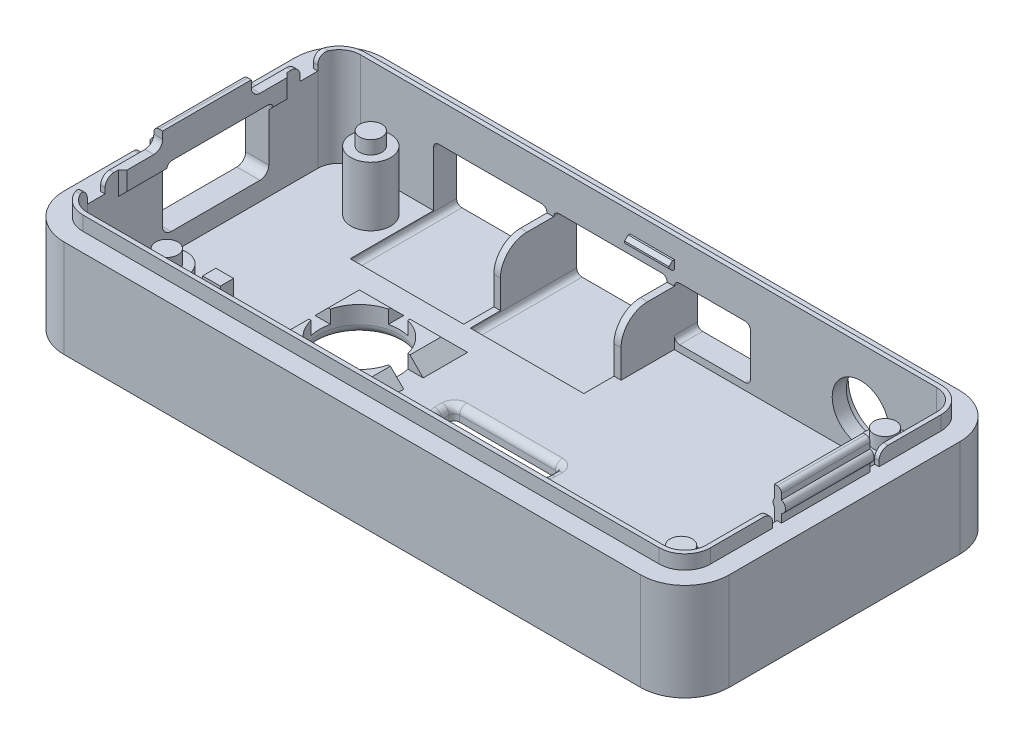
from build123d import *

# Parameters (mm, degrees)
EXTRUDE_2_DEPTH       = 11
EXTRUDE_4_DEPTH       = 1.6
CUT_EXTRUDE_START     = -9.5
CUT_EXTRUDE_2_DEPTH   = 9.5
EXTRUDE_12_DEPTH      = 1.6
EXTRUDE_12_DEPTH_BACK = 2
SKETCH_5_W            = 0.3
SKETCH_5_H            = 10
SKETCH_15_R           = 2.25
EXTRUDE_13_DEPTH      = 6.7
SKETCH_16_R           = 1.25
EXTRUDE_14_DEPTH      = 1.5
SKETCH_17_W           = 0.5
SKETCH_17_H           = 1
CUT_EXTRUDE_3_DEPTH   = 1.6
SKETCH_19_W           = 0.8
SKETCH_19_H           = 10
EXTRUDE_15_DEPTH      = 1.8
SKETCH_20_R           = 0.7
EXTRUDE_16_DEPTH      = 10
FILLET_4_R            = 0.5
SKETCH_37_W           = 5
SKETCH_37_H           = 1
EXTRUDE_17_DEPTH      = 0.6
CHAMFER_1_SIZE        = 0.4
SKETCH_38_W           = 6
SKETCH_38_H           = 1
EXTRUDE_18_DEPTH      = 0.7
CHAMFER_2_SIZE        = 0.4
SKETCH_39_R           = 4
CUT_EXTRUDE_4_DEPTH   = 1
SKETCH_41_W           = 8.6
SKETCH_41_H           = 6
SKETCH_41_W_2         = 12.8
SKETCH_41_H_2         = 7.5
CUT_EXTRUDE_5_DEPTH   = 12
FILLET_5_R            = 0.6
SKETCH_42_R           = 3.2
CUT_EXTRUDE_6_DEPTH   = 1.6
CUT_EXTRUDE_8_REACH   = 80.462
SKETCH_44_W           = 12
SKETCH_44_H           = 7.4
SKETCH_46_W           = 20
SKETCH_46_H           = 1.6
EXTRUDE_19_DEPTH      = 0.5
CHAMFER_3_SIZE        = 1
CHAMFER_4_SIZE        = 1
FILLET_7_R            = 1
SKETCH_47_W           = 0.75
SKETCH_47_H           = 6.17888613
SKETCH_47_W_2         = 0.8
EXTRUDE_20_DEPTH      = 6
FILLET_8_R            = 3
SKETCH_48_W           = 1
SKETCH_48_H           = 10
EXTRUDE_21_DEPTH      = 1.8
SKETCH_49_R           = 0.7
EXTRUDE_22_DEPTH      = 10
SKETCH_50_W           = 0.5
SKETCH_50_H           = 2
CUT_EXTRUDE_10_DEPTH  = 1.6
FILLET_9_R            = 1
FILLET_10_R           = 0.6
FILLET_11_R           = 0.6
FILLET_12_R           = 0.6
SKETCH_51_W           = 12
SKETCH_51_H           = 2
CUT_EXTRUDE_11_DEPTH  = 1.5
FILLET_13_R           = 0.6
SKETCH_52_W           = 9.2
SKETCH_52_H           = 9.2
EXTRUDE_23_DEPTH      = 1.5
CHAMFER_5_SIZE        = 1.5
CUT_EXTRUDE_12_REACH  = 47.339
SKETCH_53_R           = 4.5
FILLET_14_R           = 1
SKETCH_55_W           = 12.2
SKETCH_55_H           = 2.2
CUT_EXTRUDE_13_DEPTH  = 1.5
SKETCH_56_W           = 2.2
SKETCH_56_H           = 12.2
CUT_EXTRUDE_14_DEPTH  = 1.5
CUT_EXTRUDE_15_DEPTH  = 0.5
FILLET_15_R           = 0.8
FILLET_17_R           = 1
SKETCH_63_W           = 2
SKETCH_63_H           = 1.5
EXTRUDE_24_DEPTH      = 2


# Some blends are built 0.0001 mm under size
with BuildPart() as part:
    # case 2 → 凸台-拉伸2 (new body)
    with BuildSketch(Plane(origin=(0, 0, 0), x_dir=(1, 0, 0), z_dir=(0, 1, 0))):
        with BuildLine():
            Line((-34.042196447, 18), (30.957803553, 18))
            ThreePointArc((30.957803553, 18), (34.493337459, 16.535533906), (35.957803553, 13))
            Line((35.957803553, 13), (35.957803553, -13))
            ThreePointArc((35.957803553, -13), (34.493337459, -16.535533906), (30.957803553, -18))
            Line((30.957803553, -18), (-34.042196447, -18))
            ThreePointArc((-34.042196447, -18), (-37.577730353, -16.535533906), (-39.042196447, -13))
            Line((-39.042196447, -13), (-39.042196447, 13))
            ThreePointArc((-39.042196447, 13), (-37.577730353, 16.535533906), (-34.042196447, 18))
        make_face()
    extrude(amount=EXTRUDE_2_DEPTH)

    # 草图3 → 凸台-拉伸4 (add)
    with BuildSketch(Plane(origin=(0, 11, 0), x_dir=(1, 0, 0), z_dir=(0, 1, 0))):
        with BuildLine():
            Line((-36.942196447, 13), (-36.942196447, -13))
            ThreePointArc((-36.942196447, -13), (-36.092806113, -15.050609665), (-34.042196447, -15.9))
            Line((-34.042196447, -15.9), (30.957803553, -15.9))
            ThreePointArc((30.957803553, -15.9), (33.008413218, -15.050609665), (33.857803553, -13))
            Line((33.857803553, -13), (33.857803553, 13))
            ThreePointArc((33.857803553, 13), (33.008413218, 15.050609665), (30.957803553, 15.9))
            Line((30.957803553, 15.9), (-34.042196447, 15.9))
            ThreePointArc((-34.042196447, 15.9), (-36.092806113, 15.050609665), (-36.942196447, 13))
        make_face()
        with BuildLine():
            Line((-34.042196447, -15.4), (30.957803553, -15.4))
            ThreePointArc((30.957803553, -15.4), (32.654859828, -14.697056275), (33.357803553, -13))
            Line((33.357803553, -13), (33.357803553, 13))
            ThreePointArc((33.357803553, 13), (32.654859828, 14.697056275), (30.957803553, 15.4))
            Line((30.957803553, 15.4), (-34.042196447, 15.4))
            ThreePointArc((-34.042196447, 15.4), (-35.739252722, 14.697056275), (-36.442196447, 13))
            Line((-36.442196447, 13), (-36.442196447, -13))
            ThreePointArc((-36.442196447, -13), (-35.739252722, -14.697056275), (-34.042196447, -15.4))
        make_face(mode=Mode.SUBTRACT)
    extrude(amount=EXTRUDE_4_DEPTH)

    # 草图14 → 切除-拉伸2 (cut)
    with BuildSketch(Plane(origin=(0, 11, 0), x_dir=(1, 0, 0), z_dir=(0, 1, 0)).offset(CUT_EXTRUDE_START)):
        with BuildLine():
            Line((-34.042196447, -15.4), (30.957803553, -15.4))
            ThreePointArc((30.957803553, -15.4), (32.654859828, -14.697056275), (33.357803553, -13))
            Line((33.357803553, -13), (33.357803553, 13))
            ThreePointArc((33.357803553, 13), (32.654859828, 14.697056275), (30.957803553, 15.4))
            Line((30.957803553, 15.4), (-34.042196447, 15.4))
            ThreePointArc((-34.042196447, 15.4), (-35.739252722, 14.697056275), (-36.442196447, 13))
            Line((-36.442196447, 13), (-36.442196447, -13))
            ThreePointArc((-36.442196447, -13), (-35.739252722, -14.697056275), (-34.042196447, -15.4))
        make_face()
    extrude(amount=CUT_EXTRUDE_2_DEPTH, mode=Mode.SUBTRACT)

    # 草图5 → 凸台-拉伸12 (add, two sides: drawn at the far end of the back side and taken through both)
    with BuildSketch(Plane(origin=(0, 11, 0), x_dir=(1, 0, 0), z_dir=(0, 1, 0)).offset(-EXTRUDE_12_DEPTH_BACK)):
        with Locations((33.207803553, 0)):
            Rectangle(SKETCH_5_W, SKETCH_5_H)
    extrude(amount=EXTRUDE_12_DEPTH + EXTRUDE_12_DEPTH_BACK)

    # 草图15 → 凸台-拉伸13 (add)
    with BuildSketch(Plane(origin=(0, 1.5, 0), x_dir=(1, 0, 0), z_dir=(0, 1, 0))):
        with Locations(Location((29.060337171, -11.529492838, 0), (0, 0, 270))):
            Circle(SKETCH_15_R)
        with Locations(Location((-28.939662829, -11.529492838, 0), (0, 0, 270))):
            Circle(SKETCH_15_R)
        with Locations(Location((29.060337171, 11.470507162, 0), (0, 0, 270))):
            Circle(SKETCH_15_R)
        with Locations(Location((-28.939662829, 11.470507162, 0), (0, 0, 270))):
            Circle(SKETCH_15_R)
    extrude(amount=EXTRUDE_13_DEPTH)

    # 草图16 → 凸台-拉伸14 (add)
    with BuildSketch(Plane(origin=(0, 8.2, 0), x_dir=(1, 0, 0), z_dir=(0, 1, 0))):
        with Locations(Location((29.060337171, -11.529492838, 0), (0, 0, 270))):
            Circle(SKETCH_16_R)
        with Locations(Location((29.060337171, 11.470507162, 0), (0, 0, 270))):
            Circle(SKETCH_16_R)
        with Locations(Location((-28.939662829, -11.529492838, 0), (0, 0, 270))):
            Circle(SKETCH_16_R)
        with Locations(Location((-28.939662829, 11.470507162, 0), (0, 0, 270))):
            Circle(SKETCH_16_R)
    extrude(amount=EXTRUDE_14_DEPTH)

    # 草图17 → 切除-拉伸3 (cut)
    with BuildSketch(Plane(origin=(0, 12.6, 0), x_dir=(1, 0, 0), z_dir=(0, 1, 0))):
        with Locations((33.607803553, -5.5)):
            Rectangle(SKETCH_17_W, SKETCH_17_H)
        with Locations((33.607803553, 5.5)):
            Rectangle(SKETCH_17_W, SKETCH_17_H)
    extrude(amount=-CUT_EXTRUDE_3_DEPTH, mode=Mode.SUBTRACT)

    # 草图19 → 凸台-拉伸15 (add)
    with BuildSketch(Plane(origin=(0, 12.6, 0), x_dir=(1, 0, 0), z_dir=(0, 1, 0))):
        with Locations((33.457803553, 0)):
            Rectangle(SKETCH_19_W, SKETCH_19_H)
    extrude(amount=EXTRUDE_15_DEPTH)

    # 草图20 → 凸台-拉伸16 (add)
    with BuildSketch(Plane(origin=(0, 0, -5), x_dir=(-1, 0, 0), z_dir=(0, 0, -1))):
        with Locations((-33.607803553, 12.6)):
            Circle(SKETCH_20_R)
    extrude(amount=-EXTRUDE_16_DEPTH)

    # 圆角4
    fillet_4_edges = [part.edges().sort_by_distance(p)[0] for p in [
        (33.857803553, 14.4, 0),
    ]]
    fillet(fillet_4_edges, radius=FILLET_4_R)

    # 草图37 → 凸台-拉伸17 (add)
    with BuildSketch(Plane.XY.offset(-15.4)):
        with Locations((-1.142196447, 9.8)):
            Rectangle(SKETCH_37_W, SKETCH_37_H)
    extrude(amount=EXTRUDE_17_DEPTH)

    # 倒角1
    chamfer_1_edges = [part.edges().sort_by_distance(p)[0] for p in [
        (-1.142196447, 9.3, -14.8),
        (-1.142196447, 10.3, -14.8),
    ]]
    chamfer(chamfer_1_edges, length=CHAMFER_1_SIZE)

    # 草图38 → 凸台-拉伸18 (add)
    with BuildSketch(Plane(origin=(0, 0, 15.4), x_dir=(-1, 0, 0), z_dir=(0, 0, -1))):
        with Locations((1.542196447, 9.9)):
            Rectangle(SKETCH_38_W, SKETCH_38_H)
    extrude(amount=EXTRUDE_18_DEPTH)

    # 倒角2
    chamfer_2_edges = [part.edges().sort_by_distance(p)[0] for p in [
        (-1.542196447, 10.4, 14.7),
        (-1.542196447, 9.4, 14.7),
    ]]
    chamfer(chamfer_2_edges, length=CHAMFER_2_SIZE)

    # 草图39 → 切除-拉伸4 (cut)
    with BuildSketch(Plane(origin=(0, 0, -18), x_dir=(-1, 0, 0), z_dir=(0, 0, -1))):
        with Locations((-22.372090091, 5.77888613)):
            Circle(SKETCH_39_R)
    extrude(amount=-CUT_EXTRUDE_4_DEPTH, mode=Mode.SUBTRACT)

    # 草图41 → 切除-拉伸5 (cut)
    with BuildSketch(Plane(origin=(0, 0, -18), x_dir=(-1, 0, 0), z_dir=(0, 0, -1))):
        with Locations((-5.657803553, 5.27888613)):
            Rectangle(SKETCH_41_W, SKETCH_41_H)
        with Locations((5.842196447, 4.52888613)):
            Rectangle(SKETCH_41_W_2, SKETCH_41_H_2)
        with Locations((19.392196447, 4.52888613)):
            Rectangle(SKETCH_41_W_2, SKETCH_41_H_2)
    extrude(amount=-CUT_EXTRUDE_5_DEPTH, mode=Mode.SUBTRACT)

    # 圆角5
    fillet_5_edges = [part.edges().sort_by_distance(p)[0] for p in [
        (9.957803553, 2.27888613, -16.7),
        (9.957803553, 8.27888613, -16.7),
        (1.357803553, 8.27888613, -16.7),
        (1.357803553, 2.27888613, -16.7),
        (0.557803553, 0.77888613, -12),
        (0.557803553, 8.27888613, -16.7),
        (-12.242196447, 8.27888613, -16.7),
        (-5.842196447, 0.77888613, -6),
        (-12.242196447, 0.77888613, -12),
        (-12.992196447, 0.77888613, -12),
        (-12.992196447, 8.27888613, -16.7),
        (-25.792196447, 8.27888613, -16.7),
        (-19.392196447, 0.77888613, -6),
        (-25.792196447, 0.77888613, -12),
    ]]
    fillet(fillet_5_edges, radius=FILLET_5_R)

    # 草图42 → 切除-拉伸6 (cut)
    with BuildSketch(Plane(origin=(0, 0, -17), x_dir=(-1, 0, 0), z_dir=(0, 0, -1))):
        with Locations((-22.372090091, 5.77888613)):
            Circle(SKETCH_42_R)
    extrude(amount=-CUT_EXTRUDE_6_DEPTH, mode=Mode.SUBTRACT)

    # 草图44 → 切除-拉伸8 (cut, up to next)
    with BuildSketch(Plane.ZY.offset(39.042196447), mode=Mode.PRIVATE) as cut_extrude_8_sk1:
        with Locations((-1.470507162, 7.3)):
            Rectangle(SKETCH_44_W, SKETCH_44_H)
    cut_extrude_8_tool1 = extrude(cut_extrude_8_sk1.sketch, amount=-CUT_EXTRUDE_8_REACH, mode=Mode.PRIVATE) & part.part
    add(cut_extrude_8_tool1.solids().sort_by_distance((-39.042196, 7.3, -1.470507))[0], mode=Mode.SUBTRACT)

    # 草图46 → 凸台-拉伸19 (add)
    with BuildSketch(Plane(origin=(-36.442196447, 0, 0), x_dir=(0, 0, -1), z_dir=(1, 0, 0))):
        with Locations((0, 11.8)):
            Rectangle(SKETCH_46_W, SKETCH_46_H)
    extrude(amount=EXTRUDE_19_DEPTH)

    # 倒角3
    # the kernel refuses this chamfer: 1 mm, written as the material it takes off along each edge
    with BuildSketch(Plane(origin=(-35.942196447, 15.171682988, -10), x_dir=(-0.9996219169112968, 0, -0.02749587661058555), z_dir=(0, -1, 0))) as chamfer_3_piece_1_section:
        Polygon((CHAMFER_3_SIZE * 0.999621916911, -CHAMFER_3_SIZE * 0.0274958766106), (-CHAMFER_3_SIZE * 0.0274958766106, -CHAMFER_3_SIZE * 0.999621916911), (0, 0), align=None)
    chamfer_3_piece_1 = extrude(amount=6.743365976, mode=Mode.PRIVATE)
    chamfer_3_piece_1 = split(chamfer_3_piece_1, bisect_by=Plane(origin=(-36.442196447, 11.8, -9.606598916), z_dir=(1, 0, 0)), keep=Keep.TOP, mode=Mode.PRIVATE)
    add(chamfer_3_piece_1, mode=Mode.SUBTRACT)
    with BuildSketch(Plane(origin=(-35.942196447, 8.428317012, 10), x_dir=(-0.9996219169112968, 0, 0.02749587661058555), z_dir=(0, 1, 0))) as chamfer_3_piece_2_section:
        Polygon((CHAMFER_3_SIZE * 0.999621916911, -CHAMFER_3_SIZE * 0.0274958766106), (-CHAMFER_3_SIZE * 0.0274958766106, -CHAMFER_3_SIZE * 0.999621916911), (0, 0), align=None)
    chamfer_3_piece_2 = extrude(amount=6.743365976, mode=Mode.PRIVATE)
    chamfer_3_piece_2 = split(chamfer_3_piece_2, bisect_by=Plane(origin=(-36.442196447, 11.8, 9.606598916), z_dir=(1, 0, 0)), keep=Keep.TOP, mode=Mode.PRIVATE)
    add(chamfer_3_piece_2, mode=Mode.SUBTRACT)

    # 倒角4
    # the kernel refuses this chamfer: 1 mm, written as the material it adds along each edge
    with BuildSketch(Plane(origin=(-36.442196447, 11, -12.071682988), x_dir=(0.9996219169112968, 0.02749587661058555, 0), z_dir=(0, 0, 1))) as chamfer_4_piece_1_section:
        Polygon((CHAMFER_4_SIZE * 0.999621916911, -CHAMFER_4_SIZE * 0.0274958766106), (-CHAMFER_4_SIZE * 0.0274958766106, -CHAMFER_4_SIZE * 0.999621916911), (0, 0), align=None)
    chamfer_4_piece_1 = extrude(amount=4.601175826, mode=Mode.PRIVATE)
    chamfer_4_piece_1 = split(chamfer_4_piece_1, bisect_by=Plane(origin=(-35.942196447, 10.599712488, -8.387212557), z_dir=(-1, 0, 0)), keep=Keep.TOP, mode=Mode.PRIVATE)
    chamfer_4_piece_1 = split(chamfer_4_piece_1, bisect_by=Plane(origin=(-35.787761702, 10.599712488, -8.845565255), z_dir=(-0.7071067811868302, 0, 0.7071067811862649)), keep=Keep.TOP, mode=Mode.PRIVATE)
    add(chamfer_4_piece_1)
    with BuildSketch(Plane(origin=(-36.442196447, 11, 4.529492838), x_dir=(0.9996219169112968, 0.02749587661058574, 0), z_dir=(0, 0, 1))) as chamfer_4_piece_2_section:
        Polygon((CHAMFER_4_SIZE * 0.999621916911, -CHAMFER_4_SIZE * 0.0274958766106), (-CHAMFER_4_SIZE * 0.0274958766106, -CHAMFER_4_SIZE * 0.999621916911), (0, 0), align=None)
    chamfer_4_piece_2 = extrude(amount=7.542190149, mode=Mode.PRIVATE)
    chamfer_4_piece_2 = split(chamfer_4_piece_2, bisect_by=Plane(origin=(-35.046879519, 10.603965307, 8.104683072), z_dir=(-0.7071067811868302, 0, -0.7071067811862649)), keep=Keep.TOP, mode=Mode.PRIVATE)
    chamfer_4_piece_2 = split(chamfer_4_piece_2, bisect_by=Plane(origin=(-35.942196447, 10.603965307, 6.912952994), z_dir=(-1, 0, 0)), keep=Keep.TOP, mode=Mode.PRIVATE)
    add(chamfer_4_piece_2)

    # 圆角7
    fillet_7_edges = [part.edges().sort_by_distance(p)[0] for p in [
        (-37.742196447, 3.6, 4.529492838),
        (-37.742196447, 3.6, -7.470507162),
    ]]
    fillet(fillet_7_edges, radius=FILLET_7_R)

    # 草图47 → 凸台-拉伸20 (add)
    with BuildSketch(Plane.XY.offset(-15.4)):
        with Locations((-12.617196447, 4.589443065)):
            Rectangle(SKETCH_47_W, SKETCH_47_H)
        with Locations((0.957803553, 4.589443065)):
            Rectangle(SKETCH_47_W_2, SKETCH_47_H)
    extrude(amount=EXTRUDE_20_DEPTH)

    # 圆角8
    fillet_8_edges = [part.edges().sort_by_distance(p)[0] for p in [
        (-12.617196447, 7.67888613, -9.4),
        (0.957803553, 7.67888613, -9.4),
    ]]
    fillet(fillet_8_edges, radius=FILLET_8_R)

    # 草图48 → 凸台-拉伸21 (add)
    with BuildSketch(Plane(origin=(0, 12.6, 0), x_dir=(1, 0, 0), z_dir=(0, 1, 0))):
        with Locations((-36.442196447, 0)):
            Rectangle(SKETCH_48_W, SKETCH_48_H)
    extrude(amount=EXTRUDE_21_DEPTH)

    # 草图49 → 凸台-拉伸22 (add)
    with BuildSketch(Plane.XY.offset(5)):
        with Locations((-36.692196447, 12.6)):
            Circle(SKETCH_49_R)
    extrude(amount=-EXTRUDE_22_DEPTH)

    # 草图50 → 切除-拉伸10 (cut)
    with BuildSketch(Plane(origin=(0, 12.6, 0), x_dir=(1, 0, 0), z_dir=(0, 1, 0))):
        with Locations((-36.692196447, 12)):
            Rectangle(SKETCH_50_W, SKETCH_50_H)
        with Locations((-36.692196447, -12)):
            Rectangle(SKETCH_50_W, SKETCH_50_H)
    extrude(amount=-CUT_EXTRUDE_10_DEPTH, mode=Mode.SUBTRACT)

    # 圆角9
    fillet_9_edges = [part.edges().sort_by_distance(p)[0] for p in [
        (33.607803553, 12.6, 6),
        (33.607803553, 12.6, -6),
        (-36.692196447, 12.6, -13),
        (-36.692196447, 12.6, -11),
        (-36.692196447, 12.6, 11),
        (-36.692196447, 12.6, 13),
    ]]
    fillet(fillet_9_edges, radius=FILLET_9_R)

    # 圆角10
    fillet_10_edges = [part.edges().sort_by_distance(p)[0] for p in [
        (-36.942196447, 14.4, 0),
    ]]
    fillet(fillet_10_edges, radius=FILLET_10_R)

    # 圆角11
    fillet_11_edges = [part.edges().sort_by_distance(p)[0] for p in [
        (-36.442196447, 11, -7.470507162),
        (-36.442196447, 11, 4.529492838),
    ]]
    fillet(fillet_11_edges, radius=FILLET_11_R)

    # 圆角12
    fillet_12_edges = [part.edges().sort_by_distance(p)[0] for p in [
        (-37.992196447, 11, 4.529492838),
        (-37.992196447, 11, -7.470507162),
    ]]
    fillet(fillet_12_edges, radius=FILLET_12_R)

    # 草图51 → 切除-拉伸11 (cut)
    with BuildSketch(Plane.XZ):
        with Locations((0.257803553, 3.3)):
            Rectangle(SKETCH_51_W, SKETCH_51_H)
    extrude(amount=-CUT_EXTRUDE_11_DEPTH, mode=Mode.SUBTRACT)

    # 圆角13
    fillet_13_edges = [part.edges().sort_by_distance(p)[0] for p in [
        (6.257803553, 0.75, 4.3),
        (6.257803553, 0.75, 2.3),
        (-5.742196447, 0.75, 2.3),
        (-5.742196447, 0.75, 4.3),
    ]]
    fillet(fillet_13_edges, radius=FILLET_13_R)

    # 草图52 → 凸台-拉伸23 (add)
    with BuildSketch(Plane(origin=(0, 1.5, 0), x_dir=(1, 0, 0), z_dir=(0, 1, 0))):
        with Locations((-16.127909909, -2.629492838)):
            Rectangle(SKETCH_52_W, SKETCH_52_H)
    extrude(amount=EXTRUDE_23_DEPTH)

    # 倒角5
    chamfer_5_edges = [part.edges().sort_by_distance(p)[0] for p in [
        (-16.127909909, 1.5, -1.970507162),
        (-11.527909909, 1.5, 2.629492838),
        (-16.127909909, 1.5, 7.229492838),
        (-20.727909909, 1.5, 2.629492838),
    ]]
    chamfer(chamfer_5_edges, length=CHAMFER_5_SIZE - 0.0001)  # a hair under: the kernel refuses the full size

    # 草图53 → 切除-拉伸12 (cut, up to next)
    with BuildSketch(Plane.XZ, mode=Mode.PRIVATE) as cut_extrude_12_sk1:
        with Locations(Location((-16.127909909, 2.629492838, 0), (0, 0, 270))):
            Circle(SKETCH_53_R)
    cut_extrude_12_tool1 = extrude(cut_extrude_12_sk1.sketch, amount=-CUT_EXTRUDE_12_REACH, mode=Mode.PRIVATE) & part.part
    add(cut_extrude_12_tool1.solids().sort_by_distance((-16.12791, 0, 2.629493))[0], mode=Mode.SUBTRACT)

    # 圆角14
    fillet_14_edges = [part.edges().sort_by_distance(p)[0] for p in [
        (-16.127909909, 0, 7.129492838),
    ]]
    fillet(fillet_14_edges, radius=FILLET_14_R)

    # 草图55 → 切除-拉伸13 (cut)
    with BuildSketch(Plane(origin=(0, 3, 0), x_dir=(1, 0, 0), z_dir=(0, 1, 0))):
        with Locations((-16.127909909, -2.629492838)):
            Rectangle(SKETCH_55_W, SKETCH_55_H)
    extrude(amount=-CUT_EXTRUDE_13_DEPTH, mode=Mode.SUBTRACT)

    # 草图56 → 切除-拉伸14 (cut)
    with BuildSketch(Plane(origin=(0, 3, 0), x_dir=(1, 0, 0), z_dir=(0, 1, 0))):
        with Locations((-16.127909909, -2.629492838)):
            Rectangle(SKETCH_56_W, SKETCH_56_H)
    extrude(amount=-CUT_EXTRUDE_14_DEPTH, mode=Mode.SUBTRACT)

    # 草图62 → 切除-拉伸15 (cut)
    with BuildSketch(Plane.XZ):
        with BuildLine():
            Line((24.765078465, -13.416804959), (25.178046215, -13.648590379))
            Line((25.178046215, -13.648590379), (27.32040865, -14.852196898))
            Line((27.32040865, -14.852196898), (27.73340906, -15.086834242))
            add(Edge.make_bspline(
                [(27.73340906, -15.086834242), (27.868193268, -15.159363511), (28.01677622, -15.197559368), (28.16493712, -15.195862679)],
                knots=[3, 3, 3, 3, 4, 4, 4, 4], degree=3))
            add(Edge.make_bspline(
                [(28.16493712, -15.195862679), (28.31309802, -15.194165989), (28.460802088, -15.152577152), (28.593855225, -15.076980698)],
                knots=[4, 4, 4, 4, 5, 5, 5, 5], degree=3))
            Line((28.593855225, -15.076980698), (29.001408833, -14.832946643))
            Line((29.001408833, -14.832946643), (31.115646452, -13.580594956))
            Line((31.115646452, -13.580594956), (31.523232719, -13.339412824))
            add(Edge.make_bspline(
                [(31.523232719, -13.339412824), (31.786421552, -13.18253134), (31.948431251, -12.895724589), (31.944940094, -12.590864408)],
                knots=[8, 8, 8, 8, 9, 9, 9, 9], degree=3))
            Line((31.944940094, -12.590864408), (31.905917633, -9.183285437))
            add(Edge.make_bspline(
                [(31.905917633, -9.183285437), (31.902394015, -8.875590723), (31.733891293, -8.595403795), (31.467178842, -8.444590565)],
                knots=[10, 10, 10, 10, 11, 11, 11, 11], degree=3))
            Line((31.467178842, -8.444590565), (31.054176312, -8.212805542))
            Line((31.054176312, -8.212805542), (28.911813877, -7.009199024))
            Line((28.911813877, -7.009199024), (28.498778887, -6.774579468))
            add(Edge.make_bspline(
                [(28.498778887, -6.774579468), (28.3639966, -6.699180487), (28.215411528, -6.663836952), (28.067250628, -6.665533641)],
                knots=[14, 14, 14, 14, 15, 15, 15, 15], degree=3))
            add(Edge.make_bspline(
                [(28.067250628, -6.665533641), (27.919089728, -6.667230331), (27.77138778, -6.705966847), (27.638332722, -6.784433011)],
                knots=[15, 15, 15, 15, 16, 16, 16, 16], degree=3))
            Line((27.638332722, -6.784433011), (27.230813694, -7.028449279))
            Line((27.230813694, -7.028449279), (25.116576076, -8.280800966))
            Line((25.116576076, -8.280800966), (24.709024588, -8.5219827))
            add(Edge.make_bspline(
                [(24.709024588, -8.5219827), (24.442949052, -8.678897241), (24.283793595, -8.962836401), (24.287317213, -9.270531115)],
                knots=[19, 19, 19, 19, 20, 20, 20, 20], degree=3))
            Line((24.287317213, -9.270531115), (24.326339674, -12.678110087))
            add(Edge.make_bspline(
                [(24.326339674, -12.678110087), (24.329830832, -12.982970267), (24.495479311, -13.266024786), (24.765078465, -13.416804959)],
                knots=[21, 21, 21, 21, 22, 22, 22, 22], degree=3))
        make_face()
        with BuildLine():
            Line((30.972302444, -13.006628949), (28.357122012, -14.558225628))
            add(Edge.make_bspline(
                [(28.357122012, -14.558225628), (28.235409328, -14.630857309), (28.081544582, -14.632619317), (27.955383384, -14.562826206)],
                knots=[3, 3, 3, 3, 4, 4, 4, 4], degree=3))
            Line((27.955383384, -14.562826206), (25.319583654, -13.068509707))
            add(Edge.make_bspline(
                [(25.319583654, -13.068509707), (25.184801566, -12.993128117), (25.179731003, -12.79942127), (25.312718622, -12.718103581)],
                knots=[5, 5, 5, 5, 6, 6, 6, 6], degree=3))
            Line((25.312718622, -12.718103581), (27.839559186, -11.167535932))
            add(Edge.make_bspline(
                [(27.839559186, -11.167535932), (28.009393394, -11.065847597), (28.223078974, -11.063400541), (28.395162561, -11.161173347)],
                knots=[7, 7, 7, 7, 8, 8, 8, 8], degree=3))
            add(Edge.make_bspline(
                [(28.395162561, -11.161173347), (30.987793847, -12.618921721), (30.993530353, -12.621708326)],
                knots=[0, 0, 0, 1, 1, 1], degree=2))
            add(Edge.make_bspline(
                [(30.993530353, -12.621708326), (31.128540857, -12.717035991), (31.116665297, -12.922346088), (30.972302444, -13.006628949)],
                knots=[1, 1, 1, 1, 2, 2, 2, 2], degree=3))
        make_face(mode=Mode.SUBTRACT)
        with BuildLine():
            Line((27.020813576, -8.598087216), (27.315243129, -8.429456176))
            Line((27.315243129, -8.429456176), (27.321442219, -8.970782544))
            Line((27.321442219, -8.970782544), (27.060844433, -9.104850761))
            add(Edge.make_bspline(
                [(26.590101869, -9.802671534), (26.587002225, -9.531999655), (26.738091601, -9.290919934), (27.060844433, -9.104850761)],
                knots=[0, 0, 0, 0, 1, 1, 1, 1], degree=3))
            add(Edge.make_bspline(
                [(27.086926393, -9.891020919), (26.769911988, -10.077006986), (26.593299293, -10.081881793), (26.590101869, -9.802671534)],
                knots=[6, 6, 6, 6, 7, 7, 7, 7], degree=3))
            Line((27.086926393, -9.891020919), (27.330382099, -9.751444413))
            add(Edge.make_bspline(
                [(27.358346723, -9.702687292), (27.358575139, -9.722633366), (27.347395861, -9.742710077), (27.330382099, -9.751444413)],
                knots=[4, 4, 4, 4, 5, 5, 5, 5], degree=3))
            Line((27.358346723, -9.702687292), (27.350646701, -9.030294174))
            Line((27.350646701, -9.030294174), (27.343207554, -8.380681665))
            Line((27.343207554, -8.380681665), (27.333419329, -7.525939346))
            add(Edge.make_bspline(
                [(27.333419329, -7.525939346), (27.333190913, -7.505993272), (27.341516148, -7.488801542), (27.361314394, -7.477183021)],
                knots=[3, 3, 3, 3, 4, 4, 4, 4], degree=3))
            Line((27.361314394, -7.477183021), (27.91047691, -7.157454534))
            add(Edge.make_bspline(
                [(27.91047691, -7.157454534), (27.947288719, -7.137084288), (27.993178249, -7.162194669), (27.99366774, -7.204938741)],
                knots=[5, 5, 5, 5, 6, 6, 6, 6], degree=3))
            Line((27.99366774, -7.204938741), (28.023880759, -9.843246147))
            add(Edge.make_bspline(
                [(28.023880759, -9.843246147), (28.024109175, -9.863192221), (28.015781821, -9.883236273), (27.995950915, -9.89200287)],
                knots=[7, 7, 7, 7, 8, 8, 8, 8], degree=3))
            Line((27.995950915, -9.89200287), (27.061821763, -10.435558065))
            add(Edge.make_bspline(
                [(27.061821763, -10.435558065), (26.456049391, -10.787292708), (25.952563664, -10.86144403), (25.944733005, -10.177643219)],
                knots=[9, 9, 9, 9, 10, 10, 10, 10], degree=3))
            add(Edge.make_bspline(
                [(25.944733005, -10.177643219), (25.937196079, -9.519492329), (26.440545418, -8.935285699), (27.020813576, -8.598087216)],
                knots=[10, 10, 10, 10, 11, 11, 11, 11], degree=3))
        make_face(mode=Mode.SUBTRACT)
        with BuildLine():
            Line((25.071216567, -8.797081873), (25.614673116, -8.480271026))
            add(Edge.make_bspline(
                [(25.614673116, -8.480271026), (25.651484925, -8.45990078), (25.697374655, -8.485028551), (25.697863946, -8.527755233)],
                knots=[2, 2, 2, 2, 3, 3, 3, 3], degree=3))
            Line((25.697863946, -8.527755233), (25.712252748, -9.78423618))
            add(Edge.make_bspline(
                [(25.712252748, -9.78423618), (25.712480965, -9.804164864), (25.701269227, -9.821407042), (25.684288124, -9.832993301)],
                knots=[4, 4, 4, 4, 5, 5, 5, 5], degree=3))
            Line((25.684288124, -9.832993301), (25.140799116, -10.146969614))
            add(Edge.make_bspline(
                [(25.140799116, -10.146969614), (25.103987108, -10.167322471), (25.058097577, -10.14221209), (25.057608086, -10.099468018)],
                knots=[6, 6, 6, 6, 7, 7, 7, 7], degree=3))
            Line((25.057608086, -10.099468018), (25.043252143, -8.845856384))
            add(Edge.make_bspline(
                [(25.043252143, -8.845856384), (25.043023727, -8.82591031), (25.054203005, -8.805833599), (25.071216567, -8.797081873)],
                knots=[0, 0, 0, 0, 1, 1, 1, 1], degree=3))
        make_face(mode=Mode.SUBTRACT)
        with BuildLine():
            add(Edge.make_bspline(
                [(25.395380883, -10.978959949), (25.17742707, -11.106835226), (25.020125251, -11.054495119), (25.017841292, -10.855051767), (25.015589992, -10.658460338), (25.16962907, -10.425886339), (25.387615542, -10.300862985)],
                knots=[2, 2, 2, 2, 3, 3, 3, 4, 4, 4, 4], degree=3))
            add(Edge.make_bspline(
                [(25.387615542, -10.300862985), (25.608353839, -10.170103523), (25.765690438, -10.222443232), (25.767941737, -10.419034661), (25.770258356, -10.621329937), (25.616151839, -10.851052411), (25.395380883, -10.978959949)],
                knots=[0, 0, 0, 0, 1, 1, 1, 2, 2, 2, 2], degree=3))
        make_face(mode=Mode.SUBTRACT)
    extrude(amount=-CUT_EXTRUDE_15_DEPTH, mode=Mode.SUBTRACT)

    # 圆角15
    fillet_15_edges = [part.edges().sort_by_distance(p)[0] for p in [
        (-5.742196447, 1.5, 3.3),
        (0.257803553, 1.5, 4.3),
        (0.257803553, 1.5, 2.3),
        (6.257803553, 1.5, 3.3),
        (-5.566460516, 1.5, 4.124264069),
        (-5.566460516, 1.5, 2.475735931),
        (6.082067621, 1.5, 4.124264069),
        (6.082067621, 1.5, 2.475735931),
    ]]
    fillet(fillet_15_edges, radius=FILLET_15_R)

    # 圆角17
    # the kernel refuses this fillet: 1 mm, written as the material it adds along each edge
    with BuildSketch(Plane(origin=(-36.942196447, 12.6, -5), x_dir=(0, 0, -1), z_dir=(1, 0, 0)), Plane(origin=(-35.942196447, 12.6, 5), x_dir=(0, 0, 1), z_dir=(-1, 0, 0))) as fillet_17_piece_1:
        with BuildLine():
            CenterArc((FILLET_17_R, FILLET_17_R), FILLET_17_R, 180, 90)
            Line((0, FILLET_17_R), (0, 0))
            Line((0, 0), (FILLET_17_R, 0))
        make_face()
    extrude(amount=1)

    # 草图63 → 凸台-拉伸24 (add)
    with BuildSketch(Plane(origin=(0, 1.5, 0), x_dir=(1, 0, 0), z_dir=(0, 1, 0))):
        with Locations((-29.442196447, -5.25)):
            Rectangle(SKETCH_63_W, SKETCH_63_H)
    extrude(amount=EXTRUDE_24_DEPTH)


solid = part.part
